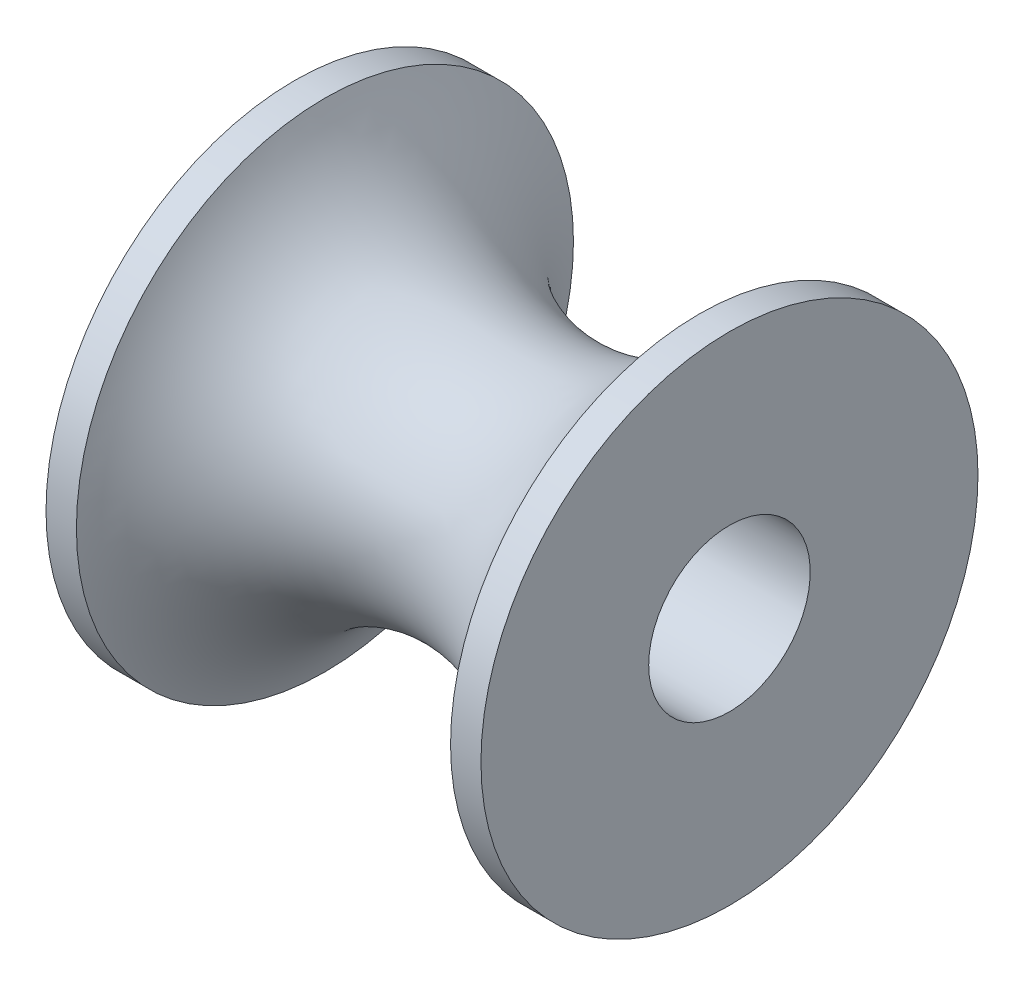
from build123d import *

# Parameters (mm, degrees)
SKETCH3_R          = 2.6
CUT_EXTRUDE1_DEPTH = 19


with BuildPart() as part:
    # Sketch2 → Revolve2 (revolve)
    with BuildSketch(Plane(origin=(0, 0, 0), x_dir=(1, 0, 0), z_dir=(0, 1, 0))):
        with BuildLine():
            Line((0, 0), (14, 0))
            Line((14, 0), (14, 8))
            Line((14, 8), (13.021433052, 8))
            ThreePointArc((13.021433052, 8), (7, 3.94792647), (0.978566948, 8))
            Line((0.978566948, 8), (0, 8))
            Line((0, 8), (0, 0))
        make_face()
    revolve(axis=Axis((0, 0, 0), (1, 0, 0)))

    # Sketch3 → Cut-Extrude1 (cut, through all)
    with BuildSketch(Plane.ZY):
        Circle(SKETCH3_R)
    extrude(amount=-CUT_EXTRUDE1_DEPTH, mode=Mode.SUBTRACT)


solid = part.part
